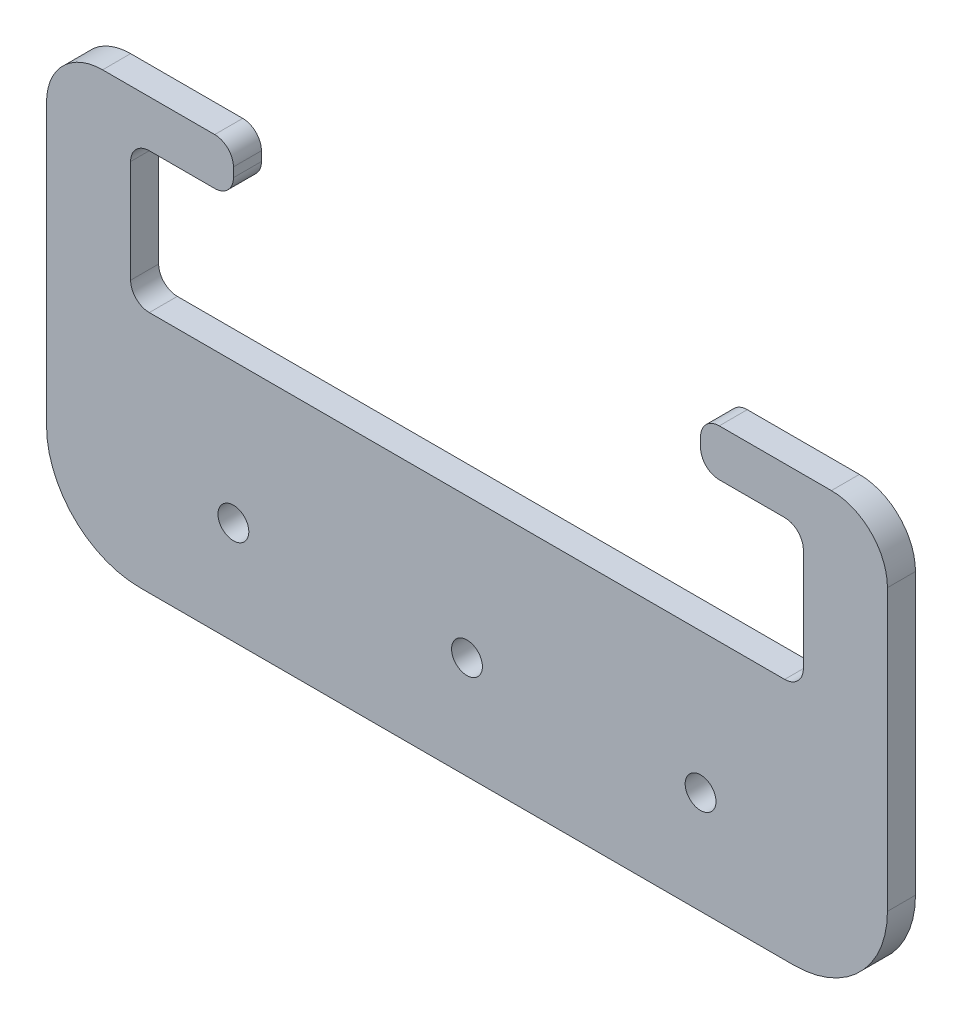
from build123d import *

# Parameters (mm, degrees)
EXTRUDE_1_DEPTH     = 3
FILLET_1_R          = 6
FILLET_2_R          = 2
SKETCH_2_R          = 1.65
CUT_EXTRUDE_1_DEPTH = 5
FILLET_3_R          = 10
SKETCH_3_W          = 90
SKETCH_3_H          = 4
CUT_EXTRUDE_2_DEPTH = 10
FILLET_4_R          = 10


with BuildPart() as part:
    # 草图1 → 凸台-拉伸1 (new body)
    with BuildSketch(Plane.XY):
        Polygon((25, 25), (45, 25), (45, -25), (-45, -25), (-45, 25), (-25, 25), (-25, 20), (-36, 20), (-36, 5), (36, 5), (36, 20), (25, 20), align=None)
    extrude(amount=EXTRUDE_1_DEPTH)

    # 圆角1
    fillet_1_edges = [part.edges().sort_by_distance(p)[0] for p in [
        (-45, 25, 1.5),
        (45, 25, 1.5),
    ]]
    fillet(fillet_1_edges, radius=FILLET_1_R)

    # 圆角2
    fillet_2_edges = [part.edges().sort_by_distance(p)[0] for p in [
        (-25, 25, 1.5),
        (-25, 20, 1.5),
        (-36, 20, 1.5),
        (-36, 5, 1.5),
        (36, 5, 1.5),
        (36, 20, 1.5),
        (25, 20, 1.5),
        (25, 25, 1.5),
    ]]
    fillet(fillet_2_edges, radius=FILLET_2_R)

    # 草图2 → 切除-拉伸1 (cut)
    with BuildSketch(Plane.XY.offset(3)):
        with Locations((-25, -10)):
            Circle(SKETCH_2_R)
        with Locations((25, -10)):
            Circle(SKETCH_2_R)
        with Locations((0, -10)):
            Circle(SKETCH_2_R)
    extrude(amount=-CUT_EXTRUDE_1_DEPTH, mode=Mode.SUBTRACT)

    # 圆角3
    fillet_3_edges = [part.edges().sort_by_distance(p)[0] for p in [
        (45, -25, 1.5),
        (-45, -25, 1.5),
    ]]
    fillet(fillet_3_edges, radius=FILLET_3_R)

    # 草图3 → 切除-拉伸2 (cut)
    with BuildSketch(Plane.XY.offset(3)):
        with Locations((0, -23)):
            Rectangle(SKETCH_3_W, SKETCH_3_H)
    extrude(amount=-CUT_EXTRUDE_2_DEPTH, mode=Mode.SUBTRACT)

    # 圆角4
    fillet_4_edges = [part.edges().sort_by_distance(p)[0] for p in [
        (43, -21, 1.5),
    ]]
    fillet(fillet_4_edges, radius=FILLET_4_R)
    fillet_4_2_edges = [part.edges().sort_by_distance(p)[0] for p in [
        (-43, -21, 1.5),
    ]]
    fillet(fillet_4_2_edges, radius=FILLET_4_R)


solid = part.part
